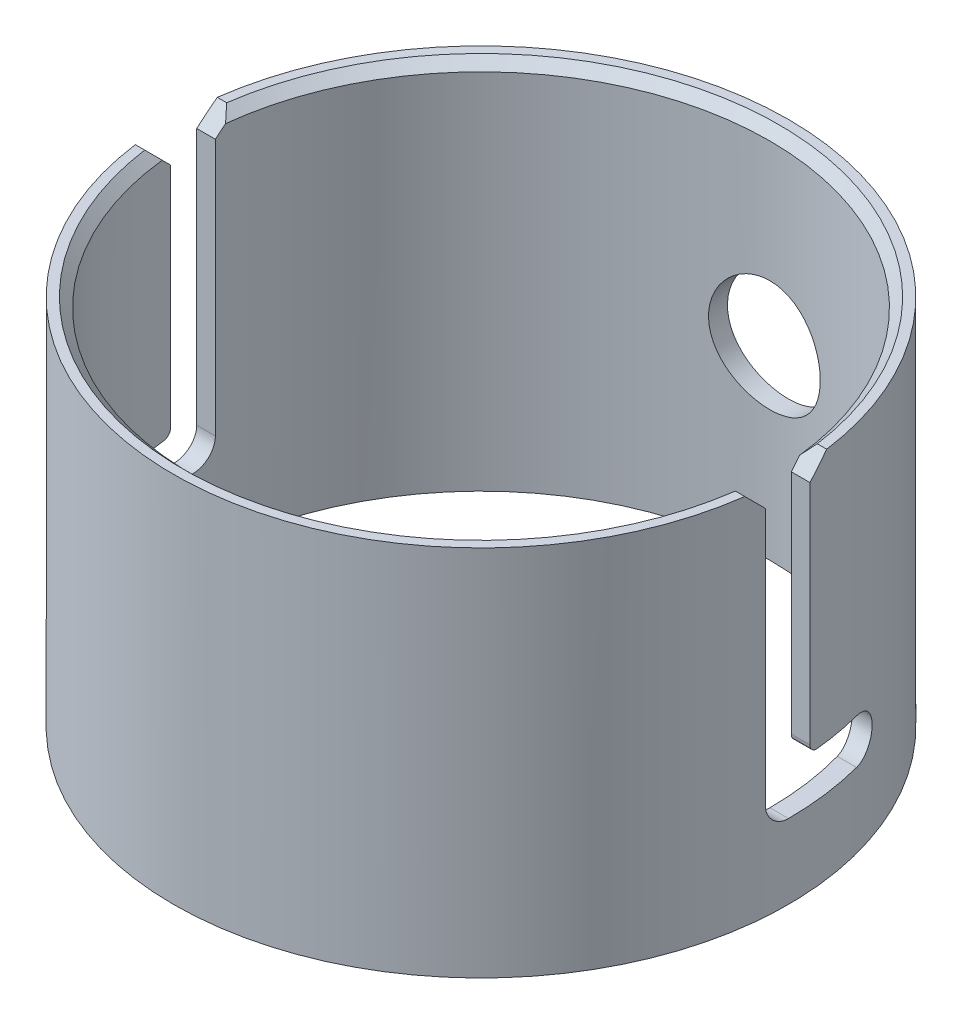
from build123d import *

# Parameters (mm, degrees)
SKETCH2_W          = 5
SKETCH2_H          = 100
CUT_EXTRUDE1_DEPTH = 154.717289203
FILLET1_R          = 6
CHAMFER1_SIZE      = 5
CHAMFER2_SIZE      = 2.5
FILLET4_R          = 2
CIRPATTERN1_START  = 72.698022634
CIRPATTERN1_DEPTH  = 9.851977366
SKETCH4_R          = 15
CUT_EXTRUDE2_DEPTH = 100


# Read off the part's stored shape, not the designer's step: CirPattern1
with BuildPart() as part:
    # Sketch2 → Revolve1 (revolve)
    with BuildSketch(Plane(origin=(0, 0, 0), x_dir=(0, 0, -1), z_dir=(1, 0, 0)), mode=Mode.PRIVATE) as revolve1_sk:
        with Locations((-80.05, 50)):
            Rectangle(SKETCH2_W, SKETCH2_H)
    revolve(revolve1_sk.sketch.rotate(Axis((0, -5, 0), (0, 1, 0)), 180), axis=Axis((0, -5, 0), (0, 1, 0)))

    # Sketch3 → Cut-Extrude1 (cut, through all)
    with BuildSketch(Plane(origin=(0, 0, 0), x_dir=(0, 0, -1), z_dir=(1, 0, 0))):
        with BuildLine():
            Line((-6, 100), (6, 100))
            Line((6, 100), (6, 20))
            Line((6, 20), (-21, 20))
            ThreePointArc((-21, 20), (-27, 26), (-21, 32))
            Line((-21, 32), (-6, 32))
            Line((-6, 32), (-6, 100))
        make_face()
    extrude(amount=-CUT_EXTRUDE1_DEPTH, mode=Mode.SUBTRACT)

    # Fillet1
    fillet1_edges = [part.edges().sort_by_distance(p)[0] for p in [
        (-79.824602438, 20, -6),
    ]]
    fillet(fillet1_edges, radius=FILLET1_R)

    # Chamfer1
    chamfer1_edges = [part.edges().sort_by_distance(p)[0] for p in [
        (-79.824602438, 100, -6),
        (-79.824602438, 100, 6),
    ]]
    chamfer(chamfer1_edges, length=CHAMFER1_SIZE)

    # Chamfer2
    chamfer2_edges = [part.edges().sort_by_distance(p)[0] for p in [
        (58.596298945, 100, 50.798388262),
    ]]
    chamfer(chamfer2_edges, length=CHAMFER2_SIZE)

    # Fillet4
    fillet4_edges = [part.edges().sort_by_distance(p)[0] for p in [
        (-79.824602438, 32, 6),
    ]]
    fillet(fillet4_edges, radius=FILLET4_R)

    # CirPattern1 outline → CirPattern1 (cut)
    with BuildSketch(Plane.YZ.offset(CIRPATTERN1_START)):
        with BuildLine():
            ThreePointArc((26, 6), (21.757359313, 4.242640687), (20, 0))
            Line((20, 0), (20, -21))
            ThreePointArc((20, -21), (26, -27), (32, -21))
            Line((32, -21), (32, -8))
            ThreePointArc((32, -8), (32.585786438, -6.585786438), (34, -6))
            Line((34, -6), (95, -6))
            Line((95, -6), (100, -11))
            Line((100, -11), (100, 11))
            Line((100, 11), (95, 6))
            Line((95, 6), (26, 6))
        make_face()
    extrude(amount=CIRPATTERN1_DEPTH, mode=Mode.SUBTRACT)

    # Sketch4 → Cut-Extrude2 (cut)
    with BuildSketch(Plane.XY):
        with Locations(Location((0, 50, 0), (0, 0, 90))):
            Circle(SKETCH4_R)
    extrude(amount=-CUT_EXTRUDE2_DEPTH, mode=Mode.SUBTRACT)


solid = part.part
